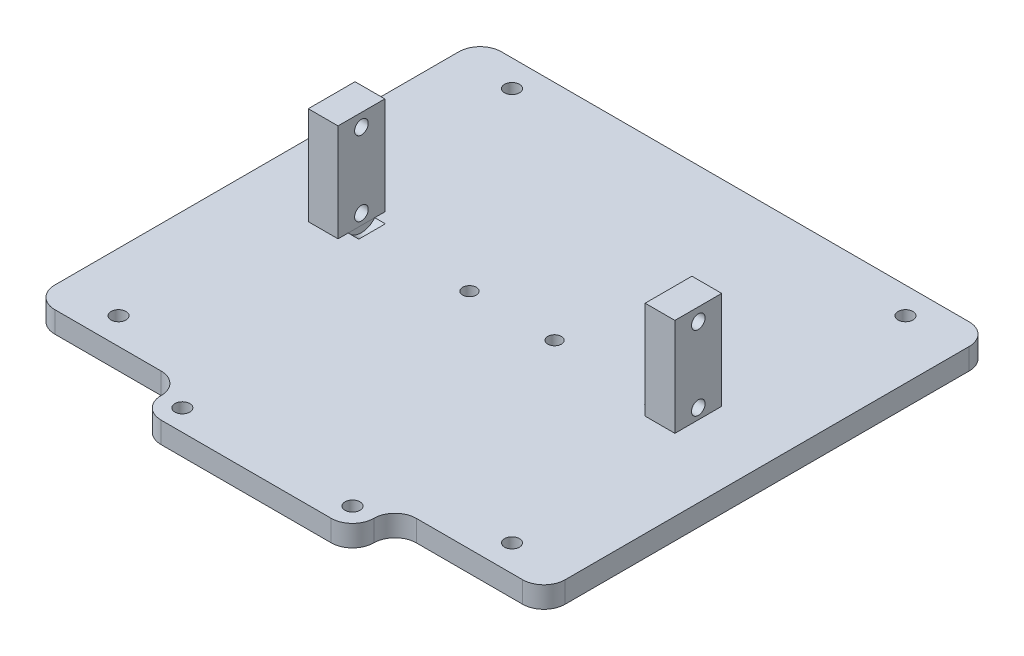
from build123d import *

# Parameters (mm, degrees)
EXTRUDE_1_DEPTH         = 5
FILLET_1_R              = 5
SKETCH_2_W              = 7
SKETCH_2_H              = 11
EXTRUDE_2_DEPTH         = 23
SKETCH_3_R              = 1.6
CUT_EXTRUDE_1_DEPTH     = 119.006186279
SKETCH_5_R              = 1.75
CUT_EXTRUDE_3_DEPTH     = 90.639556001
SKETCH_6_R              = 1.75
CUT_EXTRUDE_4_DEPTH     = 90.639556001
SKETCH2_R               = 4
CUT_EXTRUDE1_DEPTH      = 2.5
CUT_EXTRUDE2_START      = 2.5
SKETCH3_R               = 4
CUT_EXTRUDE2_DEPTH      = 2.5
CUT_EXTRUDE3_DEPTH      = 90.639556001
CUT_EXTRUDE3_DEPTH_BACK = 90.639556001
SKETCH4_R               = 1.6


with BuildPart() as part:
    # 스케치1 → 보스-돌출1 (new body)
    with BuildSketch(Plane(origin=(0, 0, 0), x_dir=(1, 0, 0), z_dir=(0, 1, 0))):
        Polygon((-25, -52.5), (-60, -52.5), (-60, 52.5), (60, 52.5), (60, -52.5), (25, -52.5), (25, -62.5), (-25, -62.5), align=None)
    extrude(amount=EXTRUDE_1_DEPTH)

    # 필렛1
    fillet_1_edges = [part.edges().sort_by_distance(p)[0] for p in [
        (60, 2.5, -52.5),
        (60, 2.5, 52.5),
        (-60, 2.5, -52.5),
        (-60, 2.5, 52.5),
        (-25, 2.5, 52.5),
        (25, 2.5, 52.5),
        (25, 2.5, 62.5),
        (-25, 2.5, 62.5),
    ]]
    fillet(fillet_1_edges, radius=FILLET_1_R - 0.0001)  # a hair under: the kernel refuses the full size

    # 스케치5 → 컷-돌출3 (cut, through all)
    with BuildSketch(Plane(origin=(0, 5, 0), x_dir=(1, 0, 0), z_dir=(0, 1, 0))):
        with Locations(Location((-46.25, -46.25, 0), (0, 0, 270))):
            Circle(SKETCH_5_R)
        with Locations(Location((-46.25, 46.25, 0), (0, 0, 270))):
            Circle(SKETCH_5_R)
        with Locations(Location((46.25, 46.25, 0), (0, 0, 270))):
            Circle(SKETCH_5_R)
        with Locations(Location((46.25, -46.25, 0), (0, 0, 270))):
            Circle(SKETCH_5_R)
    extrude(amount=-CUT_EXTRUDE_3_DEPTH, mode=Mode.SUBTRACT)

    # 스케치6 → 컷-돌출4 (cut, through all)
    with BuildSketch(Plane(origin=(0, 5, 0), x_dir=(1, 0, 0), z_dir=(0, 1, 0))):
        with Locations(Location((20, -57.5, 0), (0, 0, 270))):
            Circle(SKETCH_6_R)
        with Locations(Location((-20, -57.5, 0), (0, 0, 270))):
            Circle(SKETCH_6_R)
    extrude(amount=-CUT_EXTRUDE_4_DEPTH, mode=Mode.SUBTRACT)

    # Sketch2 → Cut-Extrude1 (cut)
    with BuildSketch(Plane.ZY.offset(-36.1)):
        with Locations((-0.7, 7.5)):
            Circle(SKETCH2_R)
    extrude(amount=CUT_EXTRUDE1_DEPTH, mode=Mode.SUBTRACT)

    # Sketch3 → Cut-Extrude2 (cut)
    with BuildSketch(Plane(origin=(-36.1, 0, 0), x_dir=(0, 0, -1), z_dir=(1, 0, 0)).offset(CUT_EXTRUDE2_START)):
        with Locations((0.7, 7.5)):
            Circle(SKETCH3_R)
    extrude(amount=-CUT_EXTRUDE2_DEPTH, mode=Mode.SUBTRACT)

    # Sketch4 → Cut-Extrude3 (cut, two sides: drawn at the far end of the back side and taken through both)
    with BuildSketch(Plane(origin=(0, 5, 0), x_dir=(1, 0, 0), z_dir=(0, 1, 0)).offset(-CUT_EXTRUDE3_DEPTH_BACK)):
        with Locations(Location((-10, 0, 0), (0, 0, 270))):
            Circle(SKETCH4_R)
        with Locations(Location((10, 0, 0), (0, 0, 270))):
            Circle(SKETCH4_R)
    extrude(amount=CUT_EXTRUDE3_DEPTH + CUT_EXTRUDE3_DEPTH_BACK, mode=Mode.SUBTRACT)


with BuildPart() as body_2:
    # 스케치2 → 보스-돌출2 (new body)
    with BuildSketch(Plane(origin=(0, 5, 0), x_dir=(1, 0, 0), z_dir=(0, 1, 0))):
        with Locations((-39.6, 0.7)):
            Rectangle(SKETCH_2_W, SKETCH_2_H)
    extrude(amount=EXTRUDE_2_DEPTH)

    # 스케치3 → 컷-돌출1 (cut, through all)
    with BuildSketch(Plane(origin=(-36.1, 0, 0), x_dir=(0, 0, -1), z_dir=(1, 0, 0))):
        with Locations((0.7, 25)):
            Circle(SKETCH_3_R)
        with Locations((0.7, 7.5)):
            Circle(SKETCH_3_R)
    extrude(amount=-CUT_EXTRUDE_1_DEPTH, mode=Mode.SUBTRACT)


with BuildPart() as body_3:
    # 대칭 복사1: mirrored copy
    add(body_2.part.mirror(Plane(origin=(0, 0, 0), x_dir=(0, 0, 1), z_dir=(1, 0, 0))))


solid = Compound([part.part, body_2.part, body_3.part])
